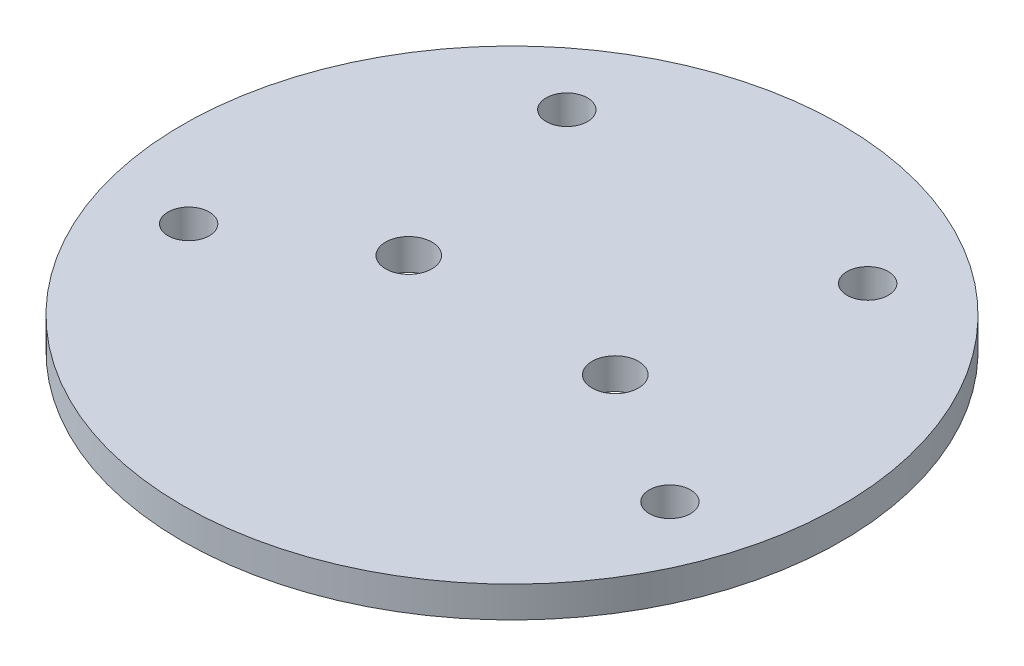
from build123d import *

# Parameters (mm, degrees)
SKETCH1_R           = 50.673
SKETCH1_R_2         = 3.5687
SKETCH1_R_3         = 3.175
BOSS_EXTRUDE1_DEPTH = 4.7752


with BuildPart() as part:
    # Sketch1 → Boss-Extrude1 (new body)
    with BuildSketch(Plane(origin=(0, 0, 0), x_dir=(1, 0, 0), z_dir=(0, 1, 0))):
        Circle(SKETCH1_R)
        with Locations((-15.875, 0)):
            Circle(SKETCH1_R_2, mode=Mode.SUBTRACT)
        with Locations((15.875, 0)):
            Circle(SKETCH1_R_2, mode=Mode.SUBTRACT)
        with Locations((-37.000474805, -12.718618741)):
            Circle(SKETCH1_R_3, mode=Mode.SUBTRACT)
        with Locations((-23.12973035, 31.556520284)):
            Circle(SKETCH1_R_3, mode=Mode.SUBTRACT)
        with Locations((23.12973035, 31.556520284)):
            Circle(SKETCH1_R_3, mode=Mode.SUBTRACT)
        with Locations((37.000474805, -12.718618741)):
            Circle(SKETCH1_R_3, mode=Mode.SUBTRACT)
    extrude(amount=BOSS_EXTRUDE1_DEPTH)


solid = part.part
